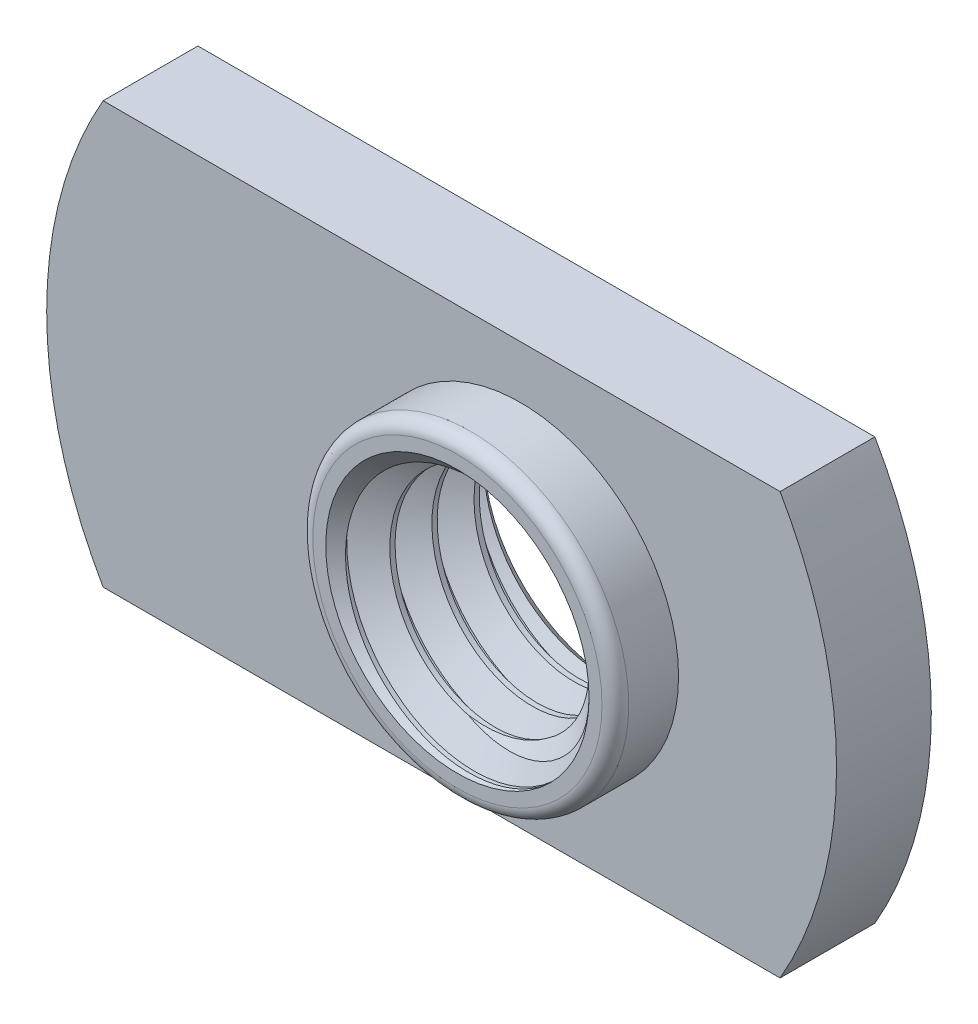
from build123d import *

# Parameters (mm, degrees)
BOSS_EXTRUDE1_START     = -1.5
BOSS_EXTRUDE1_DEPTH     = 1.8
SKETCH8_R               = 3
SKETCH8_R_2             = 2.5
BOSS_EXTRUDE2_DEPTH     = 1.2
CUT_EXTRUDE1_DEPTH      = 9.631338251
CUT_EXTRUDE1_DEPTH_BACK = 9.631338251
SKETCH9_R               = 2.5
FILLET1_R               = 0.254
SWEEP1_PITCH            = 0.8
SPLIT1_START            = -2.7460001
SPLIT1_OUTLINE_W        = 9
SPLIT1_OUTLINE_H        = 2.5
SPLIT1_DEPTH            = 5.4920002


with BuildPart() as part:
    # Sketch7 → Boss-Extrude1 (new body)
    with BuildSketch(Plane.XY.offset(BOSS_EXTRUDE1_START)):
        with BuildLine():
            Line((-6.42820323, 4), (6.42820323, 4))
            ThreePointArc((6.42820323, 4), (7.5, 0), (6.42820323, -4))
            Line((6.42820323, -4), (-6.42820323, -4))
            ThreePointArc((-6.42820323, -4), (-7.5, 0), (-6.42820323, 4))
        make_face()
    extrude(amount=BOSS_EXTRUDE1_DEPTH)

    # Sketch8 → Boss-Extrude2 (add)
    with BuildSketch(Plane.XY.offset(0.3)):
        with Locations((1.5, 0)):
            Circle(SKETCH8_R)
        with Locations((1.5, 0)):
            Circle(SKETCH8_R_2, mode=Mode.SUBTRACT)
    extrude(amount=BOSS_EXTRUDE2_DEPTH)

    # Sketch9 → Cut-Extrude1 (cut, two sides: drawn at the far end of the back side and taken through both)
    with BuildSketch(Plane.XY.offset(-CUT_EXTRUDE1_DEPTH_BACK)):
        with Locations((1.5, 0)):
            Circle(SKETCH9_R)
    extrude(amount=CUT_EXTRUDE1_DEPTH + CUT_EXTRUDE1_DEPTH_BACK, mode=Mode.SUBTRACT)

    # Fillet1
    fillet1_edges = [part.edges().sort_by_distance(p)[0] for p in [
        (-1.5, 0, 1.5),
    ]]
    fillet(fillet1_edges, radius=FILLET1_R)

    # Sweep1: arcs per turn and ends read off the stored shape
    # Sweep1: the profile of Sketch3 screwed along a right-hand helix through 4.75 turns, 8 arcs to a turn; built about Z, then put on its axis
    sweep1_z = Axis((0, 0, 0), (0, 0, 1))
    sweep1_corners = [(2.54330127, 0, 0.025), (2.54330127, 0, -0.725), (1.980384758, 0, -0.4), (1.980384758, 0, -0.3)]
    with BuildLine(mode=Mode.PRIVATE) as sweep1_profile:
        Line(sweep1_corners[0], sweep1_corners[1])
        Line(sweep1_corners[1], sweep1_corners[2])
        Line(sweep1_corners[2], sweep1_corners[3])
        Line(sweep1_corners[3], sweep1_corners[0])
    sweep1_cap = Face(sweep1_profile.wire())
    sweep1_turn_angles = [0, 22.5, 45, 67.5, 90, 112.5, 135, 157.5, 180, 202.5, 225, 247.5, 270, 292.5, 315, 337.5, 360]
    sweep1_turn_weights = [1, 0.9238795325112867, 1, 0.9238795325112867, 1, 0.9238795325112867, 1, 0.9238795325112867, 1, 0.9238795325112867, 1, 0.9238795325112867, 1, 0.9238795325112867, 1, 0.9238795325112867, 1]
    sweep1_turn_rails = [Edge.make_bspline([Vector(p[0], p[1], 0).rotate(sweep1_z, sweep1_turn_angles[k]) / sweep1_turn_weights[k] + Vector(0, 0, p[2] + SWEEP1_PITCH * sweep1_turn_angles[k] / 360) for k in range(17)], [0, 0, 0, 1, 1, 2, 2, 3, 3, 4, 4, 5, 5, 6, 6, 7, 7, 8, 8, 8], 2, sweep1_turn_weights) for p in sweep1_corners]
    sweep1_turn_sides = [Face.make_surface_from_curves(sweep1_turn_rails[p[0]], sweep1_turn_rails[p[1]]) for p in [(0, 1), (1, 2), (2, 3), (3, 0)]]
    sweep1_last_angles = [1440, 1462.5, 1485, 1507.5, 1530, 1552.5, 1575, 1597.5, 1620, 1642.5, 1665, 1687.5, 1710]
    sweep1_last_weights = [1, 0.9238795325112867, 1, 0.9238795325112867, 1, 0.9238795325112867, 1, 0.9238795325112867, 1, 0.9238795325112867, 1, 0.9238795325112776, 1]
    sweep1_last_rails = [Edge.make_bspline([Vector(p[0], p[1], 0).rotate(sweep1_z, sweep1_last_angles[k]) / sweep1_last_weights[k] + Vector(0, 0, p[2] + SWEEP1_PITCH * sweep1_last_angles[k] / 360) for k in range(13)], [0, 0, 0, 1, 1, 2, 2, 3, 3, 4, 4, 5, 5, 6, 6, 6], 2, sweep1_last_weights) for p in sweep1_corners]
    sweep1_last_sides = [Face.make_surface_from_curves(sweep1_last_rails[p[0]], sweep1_last_rails[p[1]]) for p in [(0, 1), (1, 2), (2, 3), (3, 0)]]
    sweep1 = Plane(origin=(1.5, 0, -1.5), x_dir=(0, 1, 0), z_dir=(0, 0, 1)) * Solid(Shell([*[p.moved(Location((0, 0, SWEEP1_PITCH * i))) for i in range(4) for p in sweep1_turn_sides], *sweep1_last_sides, sweep1_cap, sweep1_cap.rotate(sweep1_z, 1710).moved(Location((0, 0, SWEEP1_PITCH * 1710 / 360)))]))
    add(sweep1)

    # Split1: read off the stored shape, not the designer's step
    # Split1 outline → Split1 (cut)
    with BuildSketch(Plane(origin=(0, 0, 0), x_dir=(1, 0, 0), z_dir=(0, 1, 0)).offset(SPLIT1_START)):
        with Locations((1.5, -2.75)):
            Rectangle(SPLIT1_OUTLINE_W, SPLIT1_OUTLINE_H)
        with Locations((1.5, 2.75)):
            Rectangle(SPLIT1_OUTLINE_W, SPLIT1_OUTLINE_H)
    extrude(amount=SPLIT1_DEPTH, mode=Mode.SUBTRACT)

    # Cut-Extrude2 cone 1 section (through the dimple's axis) → Cut-Extrude2 (revolve, cut)
    with BuildSketch(Plane(origin=(1.5, 0, -1.5), x_dir=(0, 1, 0), z_dir=(1, 0, 0))):
        Polygon((0, 0), (2.5, 0), (0, 2.5), align=None)
    revolve(axis=Axis((1.5, 0, -1.5), (0, 0, 1)), mode=Mode.SUBTRACT)

    # Cut-Extrude3 cone 1 section (through the dimple's axis) → Cut-Extrude3 (revolve, cut)
    with BuildSketch(Plane(origin=(1.5, 0, 1.5), x_dir=(0, -1, 0), z_dir=(1, 0, 0))):
        Polygon((0, 0), (2.5, 0), (0, 2.5), align=None)
    revolve(axis=Axis((1.5, 0, 1.5), (0, 0, -1)), mode=Mode.SUBTRACT)


solid = part.part
